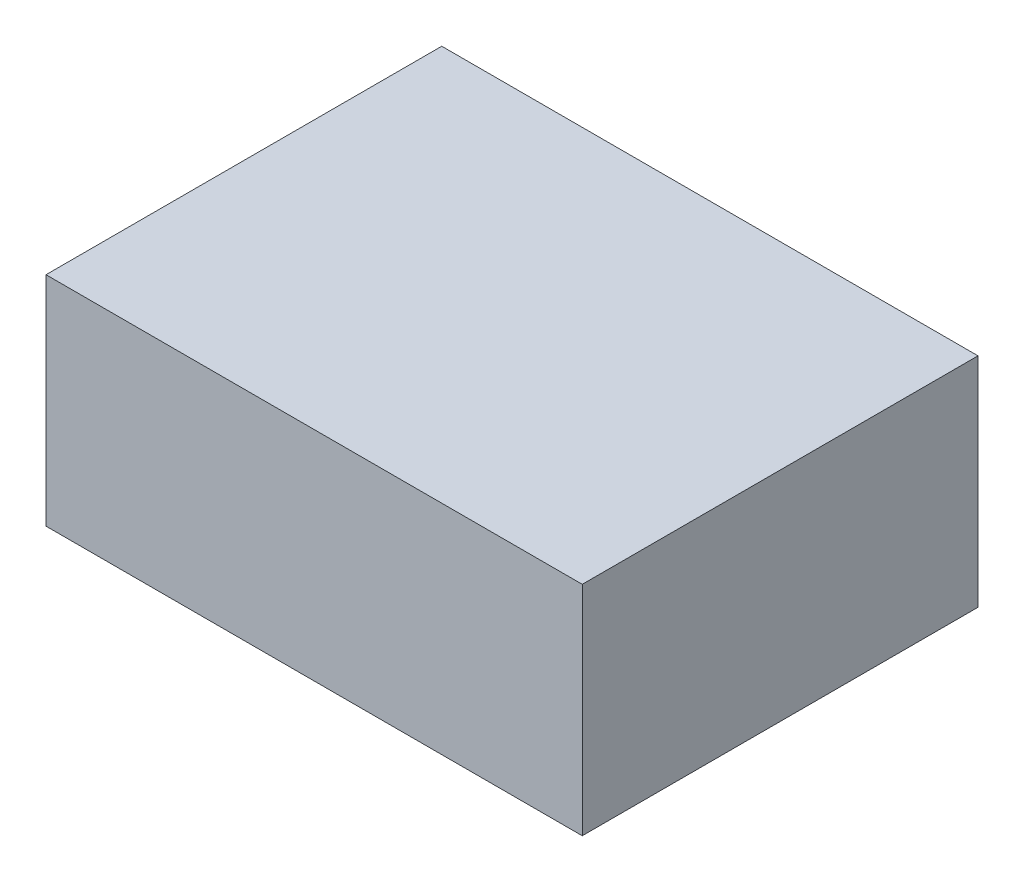
from build123d import *

# Parameters (mm, degrees)
SKETCH1_W           = 114.5
SKETCH1_H           = 84.5
BOSS_EXTRUDE3_DEPTH = 46.5


with BuildPart() as part:
    # Sketch1 → Boss-Extrude3 (new body)
    with BuildSketch(Plane(origin=(0, 0, 0), x_dir=(1, 0, 0), z_dir=(0, 1, 0))):
        with Locations((57.25, 42.25)):
            Rectangle(SKETCH1_W, SKETCH1_H)
    extrude(amount=BOSS_EXTRUDE3_DEPTH)


solid = part.part
